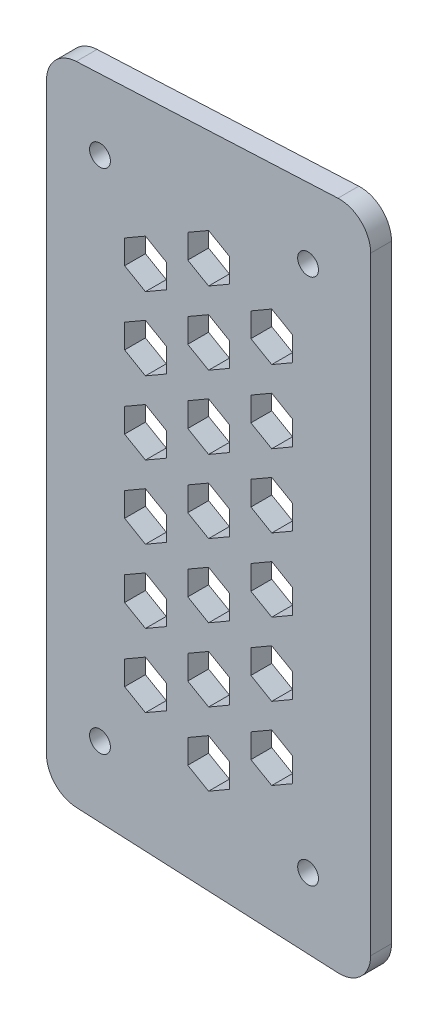
from build123d import *

# Parameters (mm, degrees)
SKETCH_1_R          = 1
EXTRUDE_1_DEPTH     = 2
FILLET_1_R          = 3
CUT_EXTRUDE_1_DEPTH = 10
OTHER_1_DEPTH       = 2


# Read off the part's stored shape, not the designer's step: 填充阵列1
with BuildPart() as part:
    # 草图1 → 凸台-拉伸1 (new body)
    with BuildSketch(Plane.XY):
        Polygon((-41.460043107, 0.647951852), (-72.584789341, 2.123935292), (-72.584789341, 63.876064708), (-41.460043107, 65.352048148), align=None)
        with Locations((-67.448676919, 57.358573192)):
            Circle(SKETCH_1_R, mode=Mode.SUBTRACT)
        with Locations((-47.471291497, 58.309400037)):
            Circle(SKETCH_1_R, mode=Mode.SUBTRACT)
        with Locations((-67.448676919, 8.641426808)):
            Circle(SKETCH_1_R, mode=Mode.SUBTRACT)
        with Locations((-47.471291497, 7.690599963)):
            Circle(SKETCH_1_R, mode=Mode.SUBTRACT)
    extrude(amount=EXTRUDE_1_DEPTH)

    # 圆角1
    fillet_1_edges = [part.edges().sort_by_distance(p)[0] for p in [
        (-41.460043107, 0.647951852, 1),
        (-72.584789341, 2.123935292, 1),
        (-72.584789341, 63.876064708, 1),
        (-41.460043107, 65.352048148, 1),
    ]]
    fillet(fillet_1_edges, radius=FILLET_1_R)

    # 草图4 → 切除-拉伸1 (cut)
    with BuildSketch(Plane.XY.offset(2)):
        Polygon((-59.022416224, 33), (-55.022416224, 33), (-55.022416224, 34.154700538), (-57.022416224, 35.309401077), (-59.022416224, 34.154700538), align=None)
        Polygon((-55.022416224, 31.845299462), (-55.022416224, 33), (-59.022416224, 33), (-59.022416224, 31.845299462), (-57.022416224, 30.690598923), align=None)
    extrude(amount=-CUT_EXTRUDE_1_DEPTH, mode=Mode.SUBTRACT)

    # 填充阵列1 outline → 填充阵列1 (cut)
    with BuildSketch(Plane.XY):
        Polygon((-61.084594051, 30.654700538), (-63.084594051, 31.809401077), (-65.084594051, 30.654700538), (-65.084594051, 28.345299462), (-63.084594051, 27.190598923), (-61.084594051, 28.345299462), align=None)
        Polygon((-48.960238398, 37.654700538), (-50.960238398, 38.809401077), (-52.960238398, 37.654700538), (-52.960238398, 35.345299462), (-50.960238398, 34.190598923), (-48.960238398, 35.345299462), align=None)
        Polygon((-48.960238398, 28.345299462), (-48.960238398, 30.654700538), (-50.960238398, 31.809401077), (-52.960238398, 30.654700538), (-52.960238398, 28.345299462), (-50.960238398, 27.190598923), align=None)
        Polygon((-61.084594051, 35.345299462), (-61.084594051, 37.654700538), (-63.084594051, 38.809401077), (-65.084594051, 37.654700538), (-65.084594051, 35.345299462), (-63.084594051, 34.190598923), align=None)
        Polygon((-57.022416224, 51.690598923), (-55.022416224, 52.845299462), (-55.022416224, 55.154700538), (-57.022416224, 56.309401077), (-59.022416224, 55.154700538), (-59.022416224, 52.845299462), align=None)
        Polygon((-57.022416224, 9.690598923), (-55.022416224, 10.845299462), (-55.022416224, 13.154700538), (-57.022416224, 14.309401077), (-59.022416224, 13.154700538), (-59.022416224, 10.845299462), align=None)
        Polygon((-57.022416224, 23.690598923), (-55.022416224, 24.845299462), (-55.022416224, 27.154700538), (-57.022416224, 28.309401077), (-59.022416224, 27.154700538), (-59.022416224, 24.845299462), align=None)
        Polygon((-57.022416224, 16.690598923), (-55.022416224, 17.845299462), (-55.022416224, 20.154700538), (-57.022416224, 21.309401077), (-59.022416224, 20.154700538), (-59.022416224, 17.845299462), align=None)
        Polygon((-57.022416224, 44.690598923), (-55.022416224, 45.845299462), (-55.022416224, 48.154700538), (-57.022416224, 49.309401077), (-59.022416224, 48.154700538), (-59.022416224, 45.845299462), align=None)
        Polygon((-57.022416224, 37.690598923), (-55.022416224, 38.845299462), (-55.022416224, 41.154700538), (-57.022416224, 42.309401077), (-59.022416224, 41.154700538), (-59.022416224, 38.845299462), align=None)
        Polygon((-61.084594051, 51.654700538), (-63.084594051, 52.809401077), (-65.084594051, 51.654700538), (-65.084594051, 49.345299462), (-63.084594051, 48.190598923), (-61.084594051, 49.345299462), align=None)
        Polygon((-48.960238398, 49.345299462), (-48.960238398, 51.654700538), (-50.960238398, 52.809401077), (-52.960238398, 51.654700538), (-52.960238398, 49.345299462), (-50.960238398, 48.190598923), align=None)
        Polygon((-48.960238398, 16.654700538), (-50.960238398, 17.809401077), (-52.960238398, 16.654700538), (-52.960238398, 14.345299462), (-50.960238398, 13.190598923), (-48.960238398, 14.345299462), align=None)
        Polygon((-61.084594051, 14.345299462), (-61.084594051, 16.654700538), (-63.084594051, 17.809401077), (-65.084594051, 16.654700538), (-65.084594051, 14.345299462), (-63.084594051, 13.190598923), align=None)
        Polygon((-48.960238398, 23.654700538), (-50.960238398, 24.809401077), (-52.960238398, 23.654700538), (-52.960238398, 21.345299462), (-50.960238398, 20.190598923), (-48.960238398, 21.345299462), align=None)
        Polygon((-50.960238398, 41.190598923), (-48.960238398, 42.345299462), (-48.960238398, 44.654700538), (-50.960238398, 45.809401077), (-52.960238398, 44.654700538), (-52.960238398, 42.345299462), align=None)
        Polygon((-61.084594051, 23.654700538), (-63.084594051, 24.809401077), (-65.084594051, 23.654700538), (-65.084594051, 21.345299462), (-63.084594051, 20.190598923), (-61.084594051, 21.345299462), align=None)
        Polygon((-63.084594051, 41.190598923), (-61.084594051, 42.345299462), (-61.084594051, 44.654700538), (-63.084594051, 45.809401077), (-65.084594051, 44.654700538), (-65.084594051, 42.345299462), align=None)
    extrude(amount=OTHER_1_DEPTH, mode=Mode.SUBTRACT)


solid = part.part
